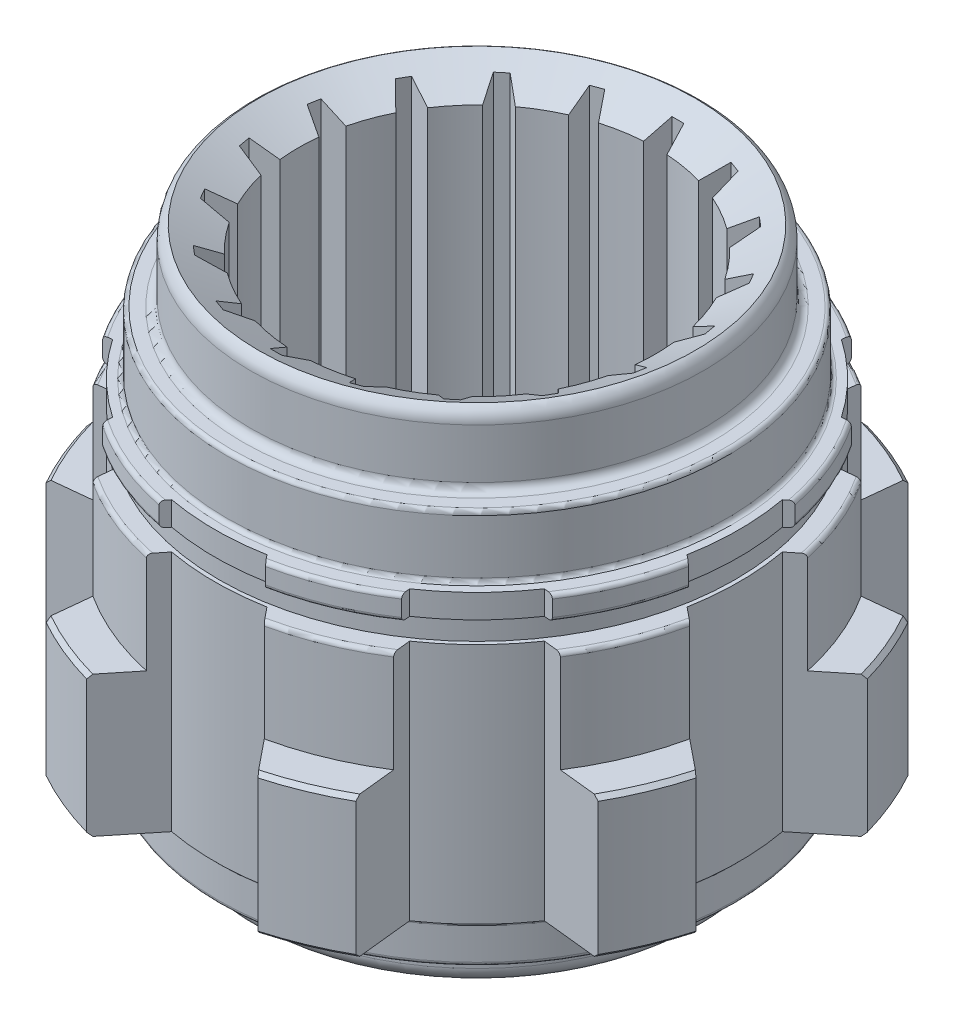
from build123d import *
from OCP.BRepFilletAPI import BRepFilletAPI_MakeChamfer

# Parameters (mm, degrees)
CHAMFER1_SIZE         = 5
CHAMFER1_SIZE2        = 2.886751346
CUT_EXTRUDE1_DEPTH    = 80
FILETE1_R             = 2
FILETE2_R             = 1
FILETE3_R             = 0.5
CHANFRO1_SIZE         = 0.5
FILETE4_R             = 2
FILETE5_R             = 0.5
CORTE_EXTRUS_O1_DEPTH = 85.528368019


with BuildPart() as part:
    # Esboço1 → Revolução1 (revolve)
    with BuildSketch(Plane.XY, mode=Mode.PRIVATE) as revolu_o1_sk:
        Polygon((22.5, 50.818468468), (28.5, 50.818468468), (28.5, 41.818468468), (31.5, 41.818468468), (31.5, 34.018468468), (34, 34.018468468), (34, 31.018468468), (32.5, 31.018468468), (32.5, 28.318468468), (35, 28.318468468), (35, 15.518468468), (39.85, 15.518468468), (39.85, -2.181531532), (32.5, -2.181531532), (32.5, -7.181531532), (28.5, -7.181531532), (28.5, -12.181531532), (22.5, -12.181531532), align=None)
    revolve(revolu_o1_sk.sketch.rotate(Axis((0, -54.461261261, 0), (0, 1, 0)), 90), axis=Axis((0, -54.461261261, 0), (0, 1, 0)))

    # Chamfer1: one chamfer whose edges measure the first distance from different faces: ONE call of the kernel's chamfer builder (chamfer() names one face for all edges)
    chamfer1_edges_1 = [part.edges().sort_by_distance(p)[0] for p in [
        (0, -12.181531532, 22.5),
    ]]
    chamfer1_side_1 = [part.faces().sort_by_distance(p)[0] for p in [
        (0, 19.318468468, 22.5),
    ]]
    chamfer1_edges_2 = [part.edges().sort_by_distance(p)[0] for p in [
        (0, 50.818468468, 22.5),
    ]]
    chamfer1_side_2 = [part.faces().sort_by_distance(p)[0] for p in [
        (0, 50.818468468, 23.306101731),
    ]]
    chamfer1 = BRepFilletAPI_MakeChamfer(part.part.solid().wrapped)
    for e in chamfer1_edges_1:
        chamfer1.Add(CHAMFER1_SIZE, CHAMFER1_SIZE2, e.wrapped, chamfer1_side_1[0].wrapped)  # the first distance lies on this face
    for e in chamfer1_edges_2:
        chamfer1.Add(CHAMFER1_SIZE, CHAMFER1_SIZE2, e.wrapped, chamfer1_side_2[0].wrapped)  # the first distance lies on this face
    add(Compound.cast(chamfer1.Shape()), mode=Mode.REPLACE)

    # Sketch1 → Cut-Extrude1 (cut)
    with BuildSketch(Plane(origin=(0, 50.818468468, 0), x_dir=(1, 0, 0), z_dir=(0, 1, 0))):
        Polygon((-1.5, 22.32144919), (1.5, 22.32144919), (0.75, 25.3), (-0.75, 25.3), align=None)
        Polygon((6.22484632, 21.488331304), (9.043924182, 20.462270874), (9.357879092, 23.517708198), (7.948340161, 24.030738413), align=None)
        Polygon((13.198884305, 18.063403529), (15.497017634, 16.1350407), (16.837059857, 18.898833704), (15.687993193, 19.863015118), align=None)
        Polygon((18.580942048, 12.459762701), (20.080942048, 9.861686489), (22.285442716, 12.000480947), (21.535442716, 13.299519053), align=None)
        Polygon((21.721863954, 5.353290604), (22.242808487, 2.398867345), (25.045872284, 3.65469308), (24.785400018, 5.13190471), align=None)
        Polygon((22.242808487, -2.398867345), (21.721863954, -5.353290604), (24.785400018, -5.13190471), (25.045872284, -3.65469308), align=None)
        Polygon((20.080942048, -9.861686489), (18.580942048, -12.459762701), (21.535442716, -13.299519053), (22.285442716, -12.000480947), align=None)
        Polygon((15.497017634, -16.1350407), (13.198884305, -18.063403529), (15.687993193, -19.863015118), (16.837059857, -18.898833704), align=None)
        Polygon((9.043924182, -20.462270874), (6.22484632, -21.488331304), (7.948340161, -24.030738413), (9.357879092, -23.517708198), align=None)
        Polygon((1.5, -22.32144919), (-1.5, -22.32144919), (-0.75, -25.3), (0.75, -25.3), align=None)
        Polygon((-6.22484632, -21.488331304), (-9.043924182, -20.462270874), (-9.357879092, -23.517708198), (-7.948340161, -24.030738413), align=None)
        Polygon((-13.198884305, -18.063403529), (-15.497017634, -16.1350407), (-16.837059857, -18.898833704), (-15.687993193, -19.863015118), align=None)
        Polygon((-18.580942048, -12.459762701), (-20.080942048, -9.861686489), (-22.285442716, -12.000480947), (-21.535442716, -13.299519053), align=None)
        Polygon((-21.721863954, -5.353290604), (-22.242808487, -2.398867345), (-25.045872284, -3.65469308), (-24.785400018, -5.13190471), align=None)
        Polygon((-22.242808487, 2.398867345), (-21.721863954, 5.353290604), (-24.785400018, 5.13190471), (-25.045872284, 3.65469308), align=None)
        Polygon((-20.080942048, 9.861686489), (-18.580942048, 12.459762701), (-21.535442716, 13.299519053), (-22.285442716, 12.000480947), align=None)
        Polygon((-15.497017634, 16.1350407), (-13.198884305, 18.063403529), (-15.687993193, 19.863015118), (-16.837059857, 18.898833704), align=None)
        Polygon((-9.043924182, 20.462270874), (-6.22484632, 21.488331304), (-7.948340161, 24.030738413), (-9.357879092, 23.517708198), align=None)
    extrude(amount=-CUT_EXTRUDE1_DEPTH, mode=Mode.SUBTRACT)

    # Filete1
    # the kernel refuses this fillet: 2 mm, written as the material it takes off along each edge
    with BuildSketch(Plane(origin=(0, 50.818468468, 0), x_dir=(0, 0, -1), z_dir=(1, 0, 0))) as filete1_piece_1:
        with BuildLine():
            CenterArc((26.5, -1.732050808), FILETE1_R, 0, 60)
            Line((28.5, -1.732050808), (28.54, -1.732050808))
            Line((28.54, -1.732050808), (28.54, 0))
            Line((28.54, 0), (28.5, 0.04))
            ThreePointArc((28.5, 0.04), (28, 0.04), (27.52, 0.034641016))
            Line((27.52, 0.034641016), (27.5, 0))
        make_face()
    revolve(axis=Axis((0, 50.818468468, 0), (0, 1, 0)), mode=Mode.SUBTRACT)

    # Filete2
    filete2_edges = [part.edges().sort_by_distance(p)[0] for p in [
        (0, 41.818468468, 28.5),
    ]]
    fillet(filete2_edges, radius=FILETE2_R)

    # Filete3
    filete3_edges = [part.edges().sort_by_distance(p)[0] for p in [
        (0, 28.318468468, 35),
        (0, 31.018468468, 34),
        (0, 34.018468468, 34),
        (0, 34.018468468, 31.5),
        (0, 41.818468468, 31.5),
    ]]
    fillet(filete3_edges, radius=FILETE3_R)

    # Chanfro1
    chanfro1_edges = [part.edges().sort_by_distance(p)[0] for p in [
        (0, -2.181531532, 39.85),
        (0, 15.518468468, 39.85),
    ]]
    chamfer(chanfro1_edges, length=CHANFRO1_SIZE)

    # Filete4
    filete4_edges = [part.edges().sort_by_distance(p)[0] for p in [
        (0, -12.181531532, 28.5),
    ]]
    fillet(filete4_edges, radius=FILETE4_R)

    # Filete5
    filete5_edges = [part.edges().sort_by_distance(p)[0] for p in [
        (0, -7.181531532, 28.5),
        (0, -7.181531532, 32.5),
        (0, -2.181531532, 32.5),
    ]]
    fillet(filete5_edges, radius=FILETE5_R)

    # Esboço2 → Corte-extrusão1 (cut, through all)
    with BuildSketch(Plane.XZ.offset(12.181531532)):
        with BuildLine():
            ThreePointArc((6, -32.449961479), (0, -33), (-6, -32.449961479))
            Line((-6, -32.449961479), (-13.697117838, -41.95511041))
            Line((-13.697117838, -41.95511041), (13.697117838, -41.95511041))
            Line((13.697117838, -41.95511041), (6, -32.449961479))
        make_face()
        with BuildLine():
            ThreePointArc((-18.702947124, -27.188228498), (-23.334523779, -23.334523779), (-27.188228498, -18.702947124))
            Line((-27.188228498, -18.702947124), (-39.352067982, -19.981418171))
            Line((-39.352067982, -19.981418171), (-19.981418171, -39.352067982))
            Line((-19.981418171, -39.352067982), (-18.702947124, -27.188228498))
        make_face()
        with BuildLine():
            ThreePointArc((-32.449961479, -6), (-33, 0), (-32.449961479, 6))
            Line((-32.449961479, 6), (-41.95511041, 13.697117838))
            Line((-41.95511041, 13.697117838), (-41.95511041, -13.697117838))
            Line((-41.95511041, -13.697117838), (-32.449961479, -6))
        make_face()
        with BuildLine():
            ThreePointArc((-27.188228498, 18.702947124), (-23.334523779, 23.334523779), (-18.702947124, 27.188228498))
            Line((-18.702947124, 27.188228498), (-19.981418171, 39.352067982))
            Line((-19.981418171, 39.352067982), (-39.352067982, 19.981418171))
            Line((-39.352067982, 19.981418171), (-27.188228498, 18.702947124))
        make_face()
        with BuildLine():
            ThreePointArc((-6, 32.449961479), (0, 33), (6, 32.449961479))
            Line((6, 32.449961479), (13.697117838, 41.95511041))
            Line((13.697117838, 41.95511041), (-13.697117838, 41.95511041))
            Line((-13.697117838, 41.95511041), (-6, 32.449961479))
        make_face()
        with BuildLine():
            ThreePointArc((18.702947124, 27.188228498), (23.334523779, 23.334523779), (27.188228498, 18.702947124))
            Line((27.188228498, 18.702947124), (39.352067982, 19.981418171))
            Line((39.352067982, 19.981418171), (19.981418171, 39.352067982))
            Line((19.981418171, 39.352067982), (18.702947124, 27.188228498))
        make_face()
        with BuildLine():
            ThreePointArc((32.449961479, 6), (33, 0), (32.449961479, -6))
            Line((32.449961479, -6), (41.95511041, -13.697117838))
            Line((41.95511041, -13.697117838), (41.95511041, 13.697117838))
            Line((41.95511041, 13.697117838), (32.449961479, 6))
        make_face()
        with BuildLine():
            ThreePointArc((27.188228498, -18.702947124), (23.334523779, -23.334523779), (18.702947124, -27.188228498))
            Line((18.702947124, -27.188228498), (19.981418171, -39.352067982))
            Line((19.981418171, -39.352067982), (39.352067982, -19.981418171))
            Line((39.352067982, -19.981418171), (27.188228498, -18.702947124))
        make_face()
    extrude(amount=-CORTE_EXTRUS_O1_DEPTH, mode=Mode.SUBTRACT)


solid = part.part
